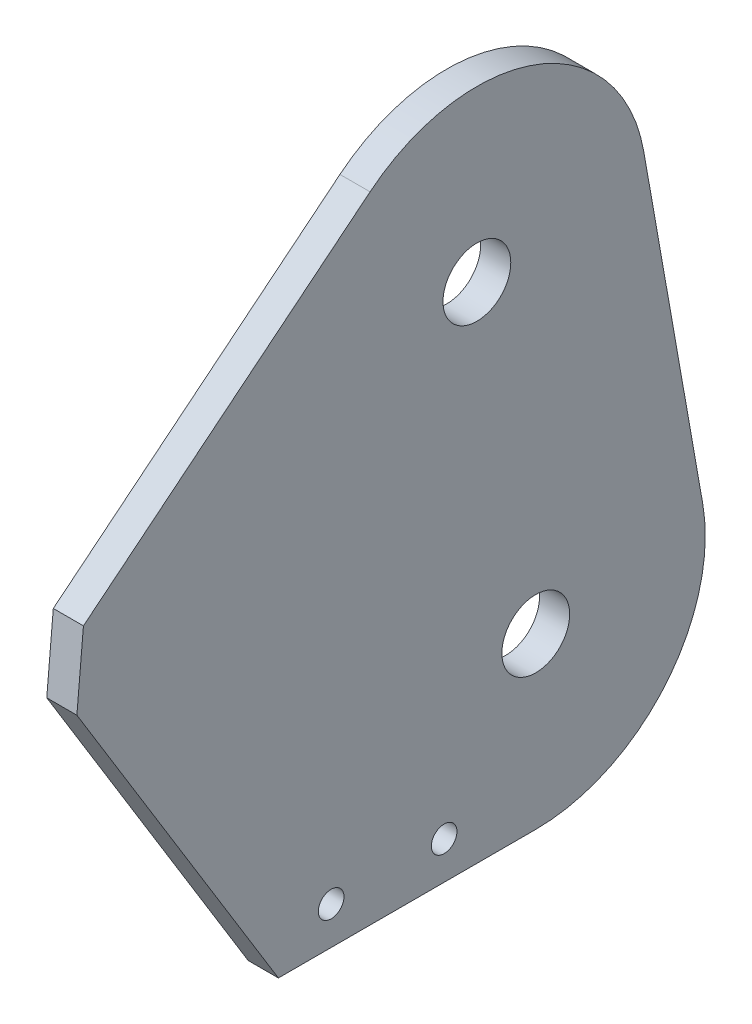
from build123d import *

# Parameters (mm, degrees)
BOSS_EXTRUDE1_DEPTH            = 4
HOLE1_D                        = 9
M3_CLEARANCE_HOLE1_D           = 3.4
M3_CLEARANCE_HOLE1_CSINK_D     = 3.45
M3_CLEARANCE_HOLE1_CSINK_ANGLE = 90


with BuildPart() as part:
    # Sketch2 → Boss-Extrude1 (new body)
    with BuildSketch(Plane.ZY.offset(18)):
        with BuildLine():
            Line((22, 38.5), (48.74840947, 82.082529594))
            Line((48.74840947, 82.082529594), (47.879285155, 91.918154789))
            Line((47.879285155, 91.918154789), (9.833581443, 122.788338637))
            ThreePointArc((9.833581443, 122.788338637), (-12.212550675, 126.395306524), (-26.501319495, 109.223432883))
            Line((-26.501319495, 109.223432883), (-34.31548749, 64.907083998))
            ThreePointArc((-34.31548749, 64.907083998), (-29.393313017, 46.537278782), (-12.157313047, 38.5))
            Line((-12.157313047, 38.5), (22, 38.5))
        make_face()
    extrude(amount=BOSS_EXTRUDE1_DEPTH)

    # Hole1 (through all)
    with Locations(Plane(origin=(-18, 0, 0), x_dir=(0, 0, -1), z_dir=(1, 0, 0))):
        with Locations((4.343145052, 105.316348886), (12.157313047, 61)):
            Hole(HOLE1_D / 2)

    # M3 Clearance Hole1 (through all)
    with Locations(Plane.ZY.offset(22)):
        with Locations((15, 43.5), (0, 43.5)):
            CounterSinkHole(M3_CLEARANCE_HOLE1_D / 2, M3_CLEARANCE_HOLE1_CSINK_D / 2, counter_sink_angle=M3_CLEARANCE_HOLE1_CSINK_ANGLE)


solid = part.part
